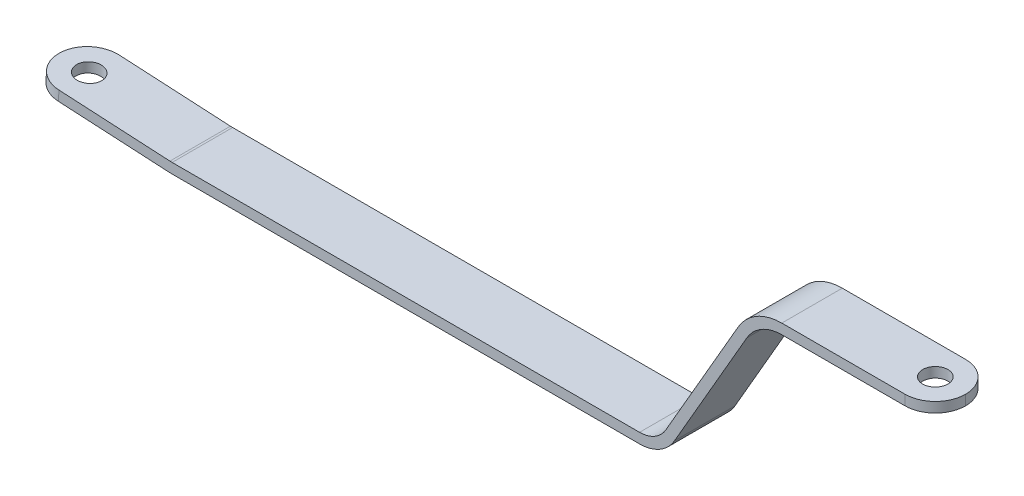
from build123d import *

# Parameters (mm, degrees)
EXTRUDE_THIN1_DEPTH = 3
CUT_EXTRUDE1_REACH  = 93.341
SKETCH2_R           = 1.25
CUT_EXTRUDE2_REACH  = 93.713
SKETCH3_R           = 1.25
FILLET1_R           = 3


with BuildPart() as part:
    # Sketch1 → Extrude-Thin1 (new, symmetric)
    with BuildSketch(Plane.XY):
        with BuildLine():
            Line((0, 0), (14.004467228, -0.760906267))
            ThreePointArc((14.004467228, -0.760906267), (14.140049985, -0.766428865), (14.275732677, -0.768270184))
            Line((14.275732677, -0.768270184), (60.65, -0.768270184))
            ThreePointArc((60.65, -0.768270184), (62.65, -0.232371799), (64.114101615, 1.231729816))
            Line((64.114101615, 1.231729816), (71.296338964, 13.671729816))
            ThreePointArc((71.296338964, 13.671729816), (72.760440579, 15.135831431), (74.760440579, 15.671729816))
            Line((74.760440579, 15.671729816), (89.99, 15.671729816))
            Line((89.99, 15.671729816), (89.99, 16.671729816))
            Line((89.99, 16.671729816), (74.760440579, 16.671729816))
            ThreePointArc((74.760440579, 16.671729816), (72.260440579, 16.001856835), (70.43031356, 14.171729816))
            Line((70.43031356, 14.171729816), (63.248076211, 1.731729816))
            ThreePointArc((63.248076211, 1.731729816), (62.15, 0.633653605), (60.65, 0.231729816))
            Line((60.65, 0.231729816), (14.275732677, 0.231729816))
            ThreePointArc((14.275732677, 0.231729816), (14.167186524, 0.233202871), (14.058720318, 0.23762095))
            Line((14.058720318, 0.23762095), (0.05425309, 0.998527217))
            Line((0.05425309, 0.998527217), (0, 0))
        make_face()
    extrude(amount=EXTRUDE_THIN1_DEPTH, both=True)

    # Sketch2 → Cut-Extrude1 (cut, up to next)
    with BuildSketch(Plane(origin=(0.054253089686214166, 0.9985272165842555, 0), x_dir=(0.998527216584255, -0.05425308968621415, 0), z_dir=(0.054253089686214145, 0.9985272165842549, 0)), mode=Mode.PRIVATE) as cut_extrude1_sk1:
        with Locations(Location((3, 0, 0), (0, 0, 180))):
            Circle(SKETCH2_R)
    cut_extrude1_tool1 = extrude(cut_extrude1_sk1.sketch, amount=-CUT_EXTRUDE1_REACH, mode=Mode.PRIVATE) & part.part
    add(cut_extrude1_tool1.solids().sort_by_distance((3.049835, 0.835768, 0))[0], mode=Mode.SUBTRACT)

    # Sketch3 → Cut-Extrude2 (cut, up to next)
    with BuildSketch(Plane(origin=(0, 16.671729816, 0), x_dir=(1, 0, 0), z_dir=(0, 1, 0)), mode=Mode.PRIVATE) as cut_extrude2_sk1:
        with Locations(Location((86.99, 0, 0), (0, 0, 270))):
            Circle(SKETCH3_R)
    cut_extrude2_tool1 = extrude(cut_extrude2_sk1.sketch, amount=-CUT_EXTRUDE2_REACH, mode=Mode.PRIVATE) & part.part
    add(cut_extrude2_tool1.solids().sort_by_distance((86.99, 16.67173, 0))[0], mode=Mode.SUBTRACT)

    # Fillet1
    fillet1_edges = [part.edges().sort_by_distance(p)[0] for p in [
        (0.027126545, 0.499263608, -3),
        (0.027126545, 0.499263608, 3),
        (89.99, 16.171729816, -3),
        (89.99, 16.171729816, 3),
    ]]
    fillet(fillet1_edges, radius=FILLET1_R - 0.0001)  # a hair under: the kernel refuses the full size


solid = part.part
